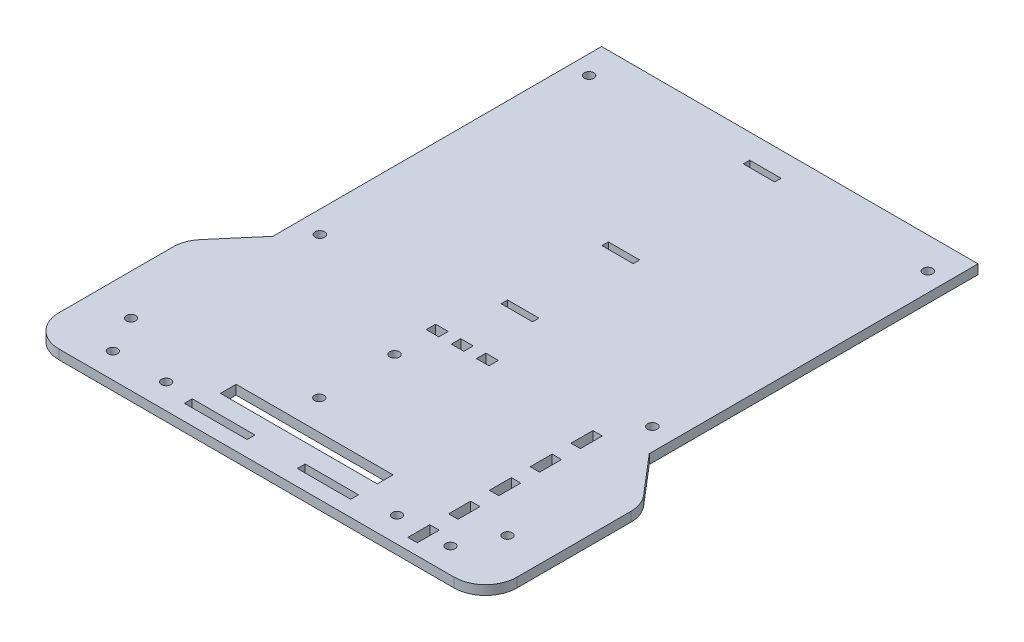
from build123d import *

# Parameters (mm, degrees)
BOSS_EXTRUDE1_DEPTH = 3
SKETCH2_R           = 1.525
CUT_EXTRUDE1_DEPTH  = 113.084789334
SKETCH3_W           = 10
SKETCH3_H           = 2.05
CUT_EXTRUDE2_DEPTH  = 113.084789334
SKETCH4_R           = 1.5
CUT_EXTRUDE3_DEPTH  = 3
SKETCH5_R           = 1.5
SKETCH5_W           = 50
SKETCH5_H           = 5
CUT_EXTRUDE4_DEPTH  = 3
SKETCH6_W           = 3
SKETCH6_H           = 7
SKETCH6_W_2         = 4
SKETCH6_H_2         = 3
CUT_EXTRUDE5_DEPTH  = 10
SKETCH7_W           = 20
SKETCH7_H           = 2.5
SKETCH7_W_2         = 17
SKETCH7_R           = 1.5
CUT_EXTRUDE6_DEPTH  = 10
FILLET3_R           = 10


with BuildPart() as part:
    # Sketch1 → Boss-Extrude1 (new body)
    with BuildSketch(Plane(origin=(0, 0, 0), x_dir=(1, 0, 0), z_dir=(0, 1, 0))):
        Polygon((-73, -35), (-60, -19.801315846), (-60, 85), (60, 85), (60, -19.801315846), (73, -35), (73, -85), (60, -85), (-60, -85), (-73, -85), align=None)
    extrude(amount=BOSS_EXTRUDE1_DEPTH)

    # Sketch2 → Cut-Extrude1 (cut, through all)
    with BuildSketch(Plane(origin=(0, 3, 0), x_dir=(1, 0, 0), z_dir=(0, 1, 0))):
        with Locations((-53, -11.81)):
            Circle(SKETCH2_R)
        with Locations((-54, 75)):
            Circle(SKETCH2_R)
        with Locations((53, -11.81)):
            Circle(SKETCH2_R)
        with Locations((54, 75)):
            Circle(SKETCH2_R)
    extrude(amount=-CUT_EXTRUDE1_DEPTH, mode=Mode.SUBTRACT)

    # Sketch3 → Cut-Extrude2 (cut, through all)
    with BuildSketch(Plane(origin=(0, 3, 0), x_dir=(1, 0, 0), z_dir=(0, 1, 0))):
        with Locations((0, 31.115)):
            Rectangle(SKETCH3_W, SKETCH3_H)
        with Locations((0, -0.985)):
            Rectangle(SKETCH3_W, SKETCH3_H)
        with Locations((0, 76.215)):
            Rectangle(SKETCH3_W, SKETCH3_H)
    extrude(amount=-CUT_EXTRUDE2_DEPTH, mode=Mode.SUBTRACT)

    # Sketch4 → Cut-Extrude3 (cut)
    with BuildSketch(Plane(origin=(0, 3, 0), x_dir=(1, 0, 0), z_dir=(0, 1, 0))):
        with Locations((-60, -65)):
            Circle(SKETCH4_R)
        with Locations((-53.815341562, -77)):
            Circle(SKETCH4_R)
        with Locations((53.815341562, -77)):
            Circle(SKETCH4_R)
        with Locations((60, -65)):
            Circle(SKETCH4_R)
    extrude(amount=-CUT_EXTRUDE3_DEPTH, mode=Mode.SUBTRACT)

    # Sketch5 → Cut-Extrude4 (cut)
    with BuildSketch(Plane(origin=(0, 3, 0), x_dir=(1, 0, 0), z_dir=(0, 1, 0))):
        with Locations((-36.8, -77)):
            Circle(SKETCH5_R)
        with Locations((36.8, -77)):
            Circle(SKETCH5_R)
        with Locations((0, -69)):
            Rectangle(SKETCH5_W, SKETCH5_H)
    extrude(amount=-CUT_EXTRUDE4_DEPTH, mode=Mode.SUBTRACT)

    # Sketch6 → Cut-Extrude5 (cut)
    with BuildSketch(Plane(origin=(0, 3, 0), x_dir=(1, 0, 0), z_dir=(0, 1, 0))):
        with Locations((46.136540545, -38.903152086)):
            Rectangle(SKETCH6_W, SKETCH6_H)
        with Locations((46.136540545, -25.903152086)):
            Rectangle(SKETCH6_W, SKETCH6_H)
        with Locations((46.136540545, -51.903152086)):
            Rectangle(SKETCH6_W, SKETCH6_H)
        with Locations((46.136540545, -64.903152086)):
            Rectangle(SKETCH6_W, SKETCH6_H)
        with Locations((46.136540545, -77.903152086)):
            Rectangle(SKETCH6_W, SKETCH6_H)
        with Locations((-7.792986594, -19.611957777)):
            Rectangle(SKETCH6_W_2, SKETCH6_H_2)
        with Locations((0.207013406, -19.603276843)):
            Rectangle(SKETCH6_W_2, SKETCH6_H_2)
        with Locations((8.207013406, -19.603276843)):
            Rectangle(SKETCH6_W_2, SKETCH6_H_2)
    extrude(amount=-CUT_EXTRUDE5_DEPTH, mode=Mode.SUBTRACT)

    # Sketch7 → Cut-Extrude6 (cut)
    with BuildSketch(Plane(origin=(0, 3, 0), x_dir=(1, 0, 0), z_dir=(0, 1, 0))):
        with Locations((-18, -78.75)):
            Rectangle(SKETCH7_W, SKETCH7_H)
        with Locations((16.5, -78.75)):
            Rectangle(SKETCH7_W_2, SKETCH7_H)
        with Locations((-8, -57)):
            Circle(SKETCH7_R)
        with Locations((-8, -33)):
            Circle(SKETCH7_R)
    extrude(amount=-CUT_EXTRUDE6_DEPTH, mode=Mode.SUBTRACT)

    # Fillet3
    fillet3_edges = [part.edges().sort_by_distance(p)[0] for p in [
        (-73, 1.5, 35),
        (73, 1.5, 35),
        (73, 1.5, 85),
        (-73, 1.5, 85),
    ]]
    fillet(fillet3_edges, radius=FILLET3_R)


solid = part.part
